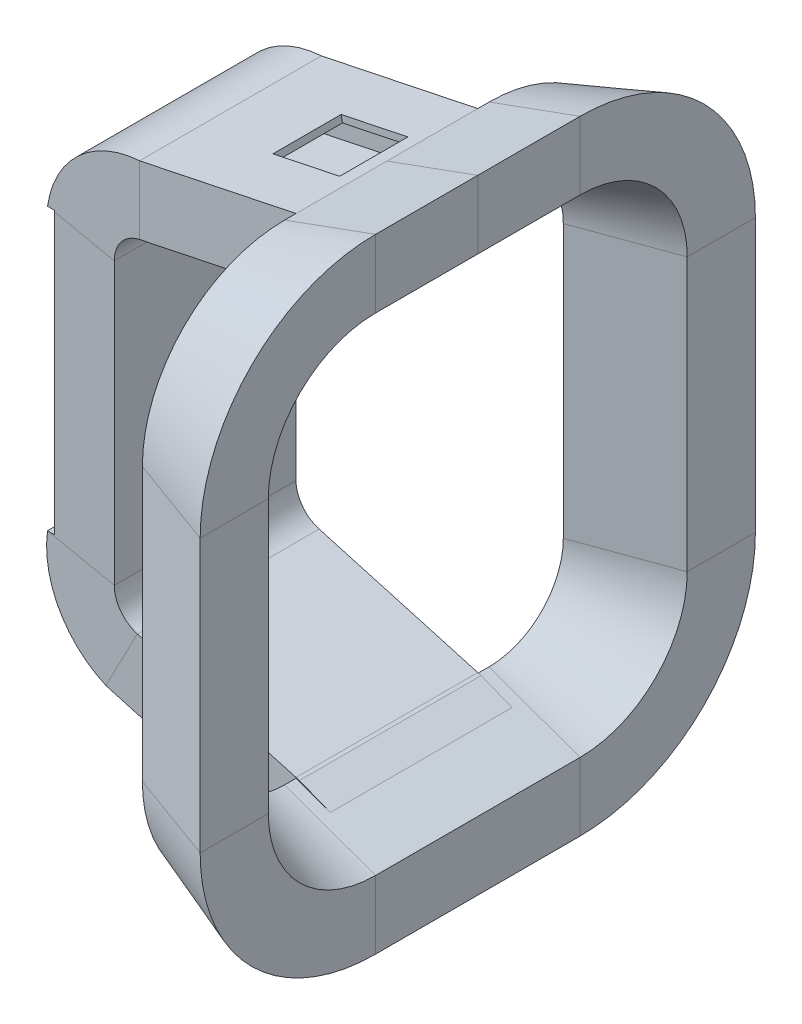
from build123d import *

# Parameters (mm, degrees)
SKETCH3_W          = 80
SKETCH3_H          = 30
SKETCH9_W          = 80
SKETCH9_H          = 1.501624929
CUT_EXTRUDE1_DEPTH = 20
CUT_EXTRUDE1_TAPER = -6
SHELL10_START      = -37
SHELL10_DEPTH      = 74
SHELL10_START_2    = -45
SHELL10_2_DEPTH    = 90
SKETCH10_W         = 30
SKETCH10_H         = 30
CUT_EXTRUDE3_DEPTH = 20
SKETCH12_W         = 80
SKETCH12_H         = 123.681881054
CUT_EXTRUDE6_DEPTH = 3
SPLIT1_START       = -40
SPLIT1_DEPTH       = 80
SPLIT1_2_DEPTH     = 80
SPLIT1_3_DEPTH     = 3
SPLIT1_START_2     = 37
SPLIT1_4_DEPTH     = 3
SPLIT1_START_3     = -37
SPLIT1_5_DEPTH     = 22
SPLIT1_START_4     = 15
SPLIT1_6_DEPTH     = 22


with BuildPart() as part:
    # Sweep1: sweep along a path in Sketch1
    with BuildLine(Plane(origin=(0, 0, 0), x_dir=(0, 0, -1), z_dir=(1, 0, 0))) as sweep1_path:
        Line((-45, 100), (45, 100))
        ThreePointArc((45, 100), (73.284271247, 88.284271247), (85, 60))
        Line((85, 60), (85, -60))
        ThreePointArc((85, -60), (73.284271247, -88.284271247), (45, -100))
        Line((45, -100), (-45, -100))
        ThreePointArc((-45, -100), (-73.284271247, -88.284271247), (-85, -60))
        Line((-85, -60), (-85, 60))
        ThreePointArc((-85, 60), (-73.284271247, 88.284271247), (-45, 100))
    # Sketch2 → Sweep1 (sweep)
    with BuildSketch(Plane.XY):
        Polygon((-20, 92.638796882), (-20, 122.638796882), (20, 137.197606252), (20, 107.197606252), align=None)
    sweep(path=sweep1_path.line)

    # Sweep2: sweep along a path in Sketch4
    with BuildLine(Plane.XY) as sweep2_path:
        Line((-20, 92.638796882), (-88.852967931, 78.306964082))
        ThreePointArc((-88.852967931, 78.306964082), (-96.861435242, 73.43415539), (-100, 64.600740168))
        Line((-100, 64.600740168), (-100, -59.081140886))
        ThreePointArc((-100, -59.081140886), (-97.167430364, -67.524392573), (-89.815928706, -72.551058781))
        Line((-89.815928706, -72.551058781), (-20, -92.32939808))
        Line((-20, -92.32939808), (-4.200687465, -96.805227161))
    # Sketch3 → Sweep2 (sweep)
    with BuildSketch(Plane.ZY.offset(20)):
        with Locations((0, 107.638796882)):
            Rectangle(SKETCH3_W, SKETCH3_H)
    sweep(path=sweep2_path.line)

    # Sketch9 → Cut-Extrude1 (cut)
    with BuildSketch(Plane(origin=(36.421438719, -19.020702104, 0), x_dir=(0, 0, -1), z_dir=(0.88640300284302, -0.4629143728065455, 0))):
        with Locations((0, -88.503815115)):
            Rectangle(SKETCH9_W, SKETCH9_H)
    extrude(amount=-CUT_EXTRUDE1_DEPTH, taper=CUT_EXTRUDE1_TAPER, mode=Mode.SUBTRACT)

    # Shell10: read off the stored shape, not the designer's step
    # Shell10 outline → Shell10 (cut)
    with BuildSketch(Plane.XY.offset(SHELL10_START)):
        with BuildLine():
            Line((-20.822955032, 95.531799063), (17, 109.298228867))
            Line((17, 109.298228867), (17, 132.913162232))
            Line((17, 132.913162232), (-19.177044968, 119.7457947))
            Line((-19.177044968, 119.7457947), (-88.451274667, 105.326275728))
            ThreePointArc((-88.451274667, 105.326275728), (-113.597851914, 94.649643041), (-126.370479816, 70.500092129))
            Line((-126.370479816, 70.500092129), (-126.370479816, -53.181788924))
            ThreePointArc((-126.370479816, -53.181788924), (-121.760302537, -78.722392286), (-102.679618525, -96.315108173))
            Line((-102.679618525, -96.315108173), (-33.069732176, -116.035077188))
            Line((-33.069732176, -116.035077188), (-19.61788718, -119.845885974))
            Line((-19.61788718, -119.845885974), (-19.503553091, -119.626955462))
            Line((-19.503553091, -119.626955462), (17, -132.913162232))
            Line((17, -132.913162232), (17, -109.298228867))
            Line((17, -109.298228867), (-5.960628872, -100.941243398))
            Line((-5.960628872, -100.941243398), (-19.484544128, -95.593482034))
            Line((-19.484544128, -95.593482034), (-20.817699008, -95.215809058))
            Line((-20.817699008, -95.215809058), (-90.633627714, -75.437469759))
            ThreePointArc((-90.633627714, -75.437469759), (-99.560451157, -69.333660792), (-103, -59.081140886))
            Line((-103, -59.081140886), (-103, 64.600740168))
            ThreePointArc((-103, 64.600740168), (-99.188885651, 75.32703008), (-89.464318202, 81.244012064))
            Line((-89.464318202, 81.244012064), (-20.822955032, 95.531799063))
        make_face()
    extrude(amount=SHELL10_DEPTH, mode=Mode.SUBTRACT)

    # Shell10 2 outline → Shell10 2 (cut)
    with BuildSketch(Plane.XY.offset(SHELL10_START_2)):
        Polygon((-17, 120.538174267), (-17, 96.923240902), (17, 109.298228867), (17, 132.913162232), align=None)
        Polygon((17, -109.298228867), (-17, -96.923240902), (-17, -120.538174267), (17, -132.913162232), align=None)
    extrude(amount=SHELL10_2_DEPTH, mode=Mode.SUBTRACT)

    # Shell10 3: loft between two sections, ruled curve by curve
    shell10_3_from = [
        Edge.make_three_point_arc((-17, 60, -105.538174267), (-17, 102.806953545, -87.806953545), (-17, 120.538174267, -45)),
        Edge.make_three_point_arc((-17, 60, -81.923240902), (-17, 86.108674025, -71.108674025), (-17, 96.923240902, -45)),
        Edge.make_three_point_arc((-17, -120.538174267, -45), (-17, -102.806953545, -87.806953545), (-17, -60, -105.538174267)),
        Edge.make_three_point_arc((-17, -96.923240902, -45), (-17, -86.108674025, -71.108674025), (-17, -60, -81.923240902)),
        Edge.make_line((-17, 60, -105.538174267), (-17, -60, -105.538174267)),
        Edge.make_line((-17, -60, -81.923240902), (-17, 60, -81.923240902)),
        Edge.make_line((-17, 96.923240902, -45), (-17, 120.538174267, -45)),
        Edge.make_line((-17, -96.923240902, -45), (-17, -120.538174267, -45)),
    ]
    shell10_3_to = [
        Edge.make_three_point_arc((17, 60, -117.913162232), (17, 111.557391452, -96.557391452), (17, 132.913162232, -45)),
        Edge.make_three_point_arc((17, 60, -94.298228867), (17, 94.859111932, -79.859111932), (17, 109.298228867, -45)),
        Edge.make_three_point_arc((17, -132.913162232, -45), (17, -111.557391452, -96.557391452), (17, -60, -117.913162232)),
        Edge.make_three_point_arc((17, -109.298228867, -45), (17, -94.859111932, -79.859111932), (17, -60, -94.298228867)),
        Edge.make_line((17, 60, -117.913162232), (17, -60, -117.913162232)),
        Edge.make_line((17, -60, -94.298228867), (17, 60, -94.298228867)),
        Edge.make_line((17, 109.298228867, -45), (17, 132.913162232, -45)),
        Edge.make_line((17, -109.298228867, -45), (17, -132.913162232, -45)),
    ]
    shell10_3 = Solid(Shell([*[Face.make_surface_from_curves(shell10_3_from[k], shell10_3_to[k]) for k in range(8)], Face(Wire(shell10_3_from)), Face(Wire(shell10_3_to))]))
    add(shell10_3, mode=Mode.SUBTRACT)

    # Shell10 4: loft between two sections, ruled curve by curve
    shell10_4_from = [
        Edge.make_three_point_arc((-17, -60, 105.538174267), (-17, -102.806953545, 87.806953545), (-17, -120.538174267, 45)),
        Edge.make_three_point_arc((-17, -60, 81.923240902), (-17, -86.108674025, 71.108674025), (-17, -96.923240902, 45)),
        Edge.make_three_point_arc((-17, 120.538174267, 45), (-17, 102.806953545, 87.806953545), (-17, 60, 105.538174267)),
        Edge.make_three_point_arc((-17, 96.923240902, 45), (-17, 86.108674025, 71.108674025), (-17, 60, 81.923240902)),
        Edge.make_line((-17, -60, 105.538174267), (-17, 60, 105.538174267)),
        Edge.make_line((-17, 60, 81.923240902), (-17, -60, 81.923240902)),
        Edge.make_line((-17, -96.923240902, 45), (-17, -120.538174267, 45)),
        Edge.make_line((-17, 96.923240902, 45), (-17, 120.538174267, 45)),
    ]
    shell10_4_to = [
        Edge.make_three_point_arc((17, -60, 117.913162232), (17, -111.557391452, 96.557391452), (17, -132.913162232, 45)),
        Edge.make_three_point_arc((17, -60, 94.298228867), (17, -94.859111932, 79.859111932), (17, -109.298228867, 45)),
        Edge.make_three_point_arc((17, 132.913162232, 45), (17, 111.557391452, 96.557391452), (17, 60, 117.913162232)),
        Edge.make_three_point_arc((17, 109.298228867, 45), (17, 94.859111932, 79.859111932), (17, 60, 94.298228867)),
        Edge.make_line((17, -60, 117.913162232), (17, 60, 117.913162232)),
        Edge.make_line((17, 60, 94.298228867), (17, -60, 94.298228867)),
        Edge.make_line((17, -109.298228867, 45), (17, -132.913162232, 45)),
        Edge.make_line((17, 109.298228867, 45), (17, 132.913162232, 45)),
    ]
    shell10_4 = Solid(Shell([*[Face.make_surface_from_curves(shell10_4_from[k], shell10_4_to[k]) for k in range(8)], Face(Wire(shell10_4_from)), Face(Wire(shell10_4_to))]))
    add(shell10_4, mode=Mode.SUBTRACT)

    # Sketch10 → Cut-Extrude3 (cut)
    with BuildSketch(Plane(origin=(-25.297880457, 121.53603633, 0), x_dir=(0.9790159938689951, 0.2037834236357412, 0), z_dir=(-0.2037834236357412, 0.9790159938689951, 0))):
        with Locations((-15.49634306, 0)):
            Rectangle(SKETCH10_W, SKETCH10_H)
    extrude(amount=-CUT_EXTRUDE3_DEPTH, mode=Mode.SUBTRACT)

    # Sketch12 → Cut-Extrude6 (cut)
    with BuildSketch(Plane.ZY.offset(129.370479816)):
        with Locations((0, 8.87330235)):
            Rectangle(SKETCH12_W, SKETCH12_H)
    extrude(amount=-CUT_EXTRUDE6_DEPTH, mode=Mode.SUBTRACT)

    # Split1: read off the stored shape, not the designer's step
    # Split1 outline → Split1 (cut)
    with BuildSketch(Plane.XY.offset(SPLIT1_START)):
        with BuildLine():
            Line((-20, -92.32939808), (-89.815928706, -72.551058781))
            ThreePointArc((-89.815928706, -72.551058781), (-97.167430364, -67.524392573), (-100, -59.081140886))
            Line((-100, -59.081140886), (-100, 64.600740168))
            ThreePointArc((-100, 64.600740168), (-96.861435242, 73.43415539), (-88.852967931, 78.306964082))
            Line((-88.852967931, 78.306964082), (-20, 92.638796882))
            Line((-20, 92.638796882), (-20, 122.638796882))
            Line((-20, 122.638796882), (-88.852967931, 108.306964082))
            ThreePointArc((-88.852967931, 108.306964082), (-115.790182146, 96.70865948), (-129.370479816, 70.714242877))
            Line((-129.370479816, 70.714242877), (-126.370479816, 70.714242877))
            Line((-126.370479816, 70.714242877), (-126.370479816, -52.967638177))
            Line((-126.370479816, -52.967638177), (-129.370479816, -52.967638177))
            ThreePointArc((-129.370479816, -52.967638177), (-124.282475377, -80.360838108), (-103.70335989, -99.143148866))
            Line((-103.70335989, -99.143148866), (-33.887431184, -118.921488166))
            Line((-33.887431184, -118.921488166), (-20, -122.855695317))
            Line((-20, -122.855695317), (-20, -92.32939808))
        make_face()
    extrude(amount=SPLIT1_DEPTH, mode=Mode.SUBTRACT)


with BuildPart() as body_2:
    # Split1 2 outline → Split1 2 (new body)
    with BuildSketch(Plane.XY.offset(SPLIT1_START)):
        Polygon((-20, 119.574495564), (-20, 122.638796882), (-25.783808251, 121.434889842), (-25.17245798, 118.49784186), align=None)
        with BuildLine():
            Line((-20, 92.638796882), (-20, 95.831330199))
            Line((-20, 95.831330199), (-20.822955032, 95.531799063))
            Line((-20.822955032, 95.531799063), (-89.464318202, 81.244012064))
            ThreePointArc((-89.464318202, 81.244012064), (-99.188885651, 75.32703008), (-103, 64.600740168))
            Line((-103, 64.600740168), (-103, -59.081140886))
            ThreePointArc((-103, -59.081140886), (-99.560451157, -69.333660792), (-90.633627714, -75.437469759))
            Line((-90.633627714, -75.437469759), (-20.817699008, -95.215809058))
            Line((-20.817699008, -95.215809058), (-20, -95.447457175))
            Line((-20, -95.447457175), (-20, -92.32939808))
            Line((-20, -92.32939808), (-89.815928706, -72.551058781))
            ThreePointArc((-89.815928706, -72.551058781), (-97.167430364, -67.524392573), (-100, -59.081140886))
            Line((-100, -59.081140886), (-100, 64.600740168))
            ThreePointArc((-100, 64.600740168), (-96.861435242, 73.43415539), (-88.852967931, 78.306964082))
            Line((-88.852967931, 78.306964082), (-20, 92.638796882))
        make_face()
        with BuildLine():
            Line((-54.542937796, 112.384339151), (-55.154288067, 115.321387133))
            Line((-55.154288067, 115.321387133), (-88.852967931, 108.306964082))
            ThreePointArc((-88.852967931, 108.306964082), (-115.790182146, 96.70865948), (-129.370479816, 70.714242877))
            Line((-129.370479816, 70.714242877), (-126.370479816, 70.714242877))
            Line((-126.370479816, 70.714242877), (-126.370479816, 70.500092129))
            ThreePointArc((-126.370479816, 70.500092129), (-113.597851914, 94.649643041), (-88.451274667, 105.326275728))
            Line((-88.451274667, 105.326275728), (-54.542937796, 112.384339151))
        make_face()
        with BuildLine():
            Line((-126.370479816, -53.181788924), (-126.370479816, -52.967638177))
            Line((-126.370479816, -52.967638177), (-129.370479816, -52.967638177))
            ThreePointArc((-129.370479816, -52.967638177), (-124.282475377, -80.360838108), (-103.70335989, -99.143148866))
            Line((-103.70335989, -99.143148866), (-33.887431184, -118.921488166))
            Line((-33.887431184, -118.921488166), (-20, -122.855695317))
            Line((-20, -122.855695317), (-20, -119.737636222))
            Line((-20, -119.737636222), (-33.069732176, -116.035077188))
            Line((-33.069732176, -116.035077188), (-102.679618525, -96.315108173))
            ThreePointArc((-102.679618525, -96.315108173), (-121.760302537, -78.722392286), (-126.370479816, -53.181788924))
        make_face()
    extrude(amount=SPLIT1_2_DEPTH)

    # Split1 3 outline → Split1 3 (add)
    with BuildSketch(Plane.XY.offset(SPLIT1_START)):
        with BuildLine():
            Line((-20, 95.831330199), (-20, 119.574495564))
            Line((-20, 119.574495564), (-25.17245798, 118.49784186))
            Line((-25.17245798, 118.49784186), (-25.783808251, 121.434889842))
            Line((-25.783808251, 121.434889842), (-55.154288067, 115.321387133))
            Line((-55.154288067, 115.321387133), (-54.542937796, 112.384339151))
            Line((-54.542937796, 112.384339151), (-88.451274667, 105.326275728))
            ThreePointArc((-88.451274667, 105.326275728), (-113.597851914, 94.649643041), (-126.370479816, 70.500092129))
            Line((-126.370479816, 70.500092129), (-126.370479816, -53.181788924))
            ThreePointArc((-126.370479816, -53.181788924), (-121.760302537, -78.722392286), (-102.679618525, -96.315108173))
            Line((-102.679618525, -96.315108173), (-33.069732176, -116.035077188))
            Line((-33.069732176, -116.035077188), (-20, -119.737636222))
            Line((-20, -119.737636222), (-20, -95.447457175))
            Line((-20, -95.447457175), (-20.817699008, -95.215809058))
            Line((-20.817699008, -95.215809058), (-90.633627714, -75.437469759))
            ThreePointArc((-90.633627714, -75.437469759), (-99.560451157, -69.333660792), (-103, -59.081140886))
            Line((-103, -59.081140886), (-103, 64.600740168))
            ThreePointArc((-103, 64.600740168), (-99.188885651, 75.32703008), (-89.464318202, 81.244012064))
            Line((-89.464318202, 81.244012064), (-20.822955032, 95.531799063))
            Line((-20.822955032, 95.531799063), (-20, 95.831330199))
        make_face()
    extrude(amount=SPLIT1_3_DEPTH)

    # Split1 4 outline → Split1 4 (add)
    with BuildSketch(Plane.XY.offset(SPLIT1_START_2)):
        with BuildLine():
            Line((-20, 95.831330199), (-20, 119.574495564))
            Line((-20, 119.574495564), (-25.17245798, 118.49784186))
            Line((-25.17245798, 118.49784186), (-25.783808251, 121.434889842))
            Line((-25.783808251, 121.434889842), (-55.154288067, 115.321387133))
            Line((-55.154288067, 115.321387133), (-54.542937796, 112.384339151))
            Line((-54.542937796, 112.384339151), (-88.451274667, 105.326275728))
            ThreePointArc((-88.451274667, 105.326275728), (-113.597851914, 94.649643041), (-126.370479816, 70.500092129))
            Line((-126.370479816, 70.500092129), (-126.370479816, -53.181788924))
            ThreePointArc((-126.370479816, -53.181788924), (-121.760302537, -78.722392286), (-102.679618525, -96.315108173))
            Line((-102.679618525, -96.315108173), (-33.069732176, -116.035077188))
            Line((-33.069732176, -116.035077188), (-20, -119.737636222))
            Line((-20, -119.737636222), (-20, -95.447457175))
            Line((-20, -95.447457175), (-20.817699008, -95.215809058))
            Line((-20.817699008, -95.215809058), (-90.633627714, -75.437469759))
            ThreePointArc((-90.633627714, -75.437469759), (-99.560451157, -69.333660792), (-103, -59.081140886))
            Line((-103, -59.081140886), (-103, 64.600740168))
            ThreePointArc((-103, 64.600740168), (-99.188885651, 75.32703008), (-89.464318202, 81.244012064))
            Line((-89.464318202, 81.244012064), (-20.822955032, 95.531799063))
            Line((-20.822955032, 95.531799063), (-20, 95.831330199))
        make_face()
    extrude(amount=SPLIT1_4_DEPTH)

    # Split1 5 outline → Split1 5 (add)
    with BuildSketch(Plane.XY.offset(SPLIT1_START_3)):
        Polygon((-25.17245798, 118.49784186), (-25.783808251, 121.434889842), (-55.154288067, 115.321387133), (-54.542937796, 112.384339151), align=None)
    extrude(amount=SPLIT1_5_DEPTH)

    # Split1 6 outline → Split1 6 (add)
    with BuildSketch(Plane.XY.offset(SPLIT1_START_4)):
        Polygon((-25.17245798, 118.49784186), (-25.783808251, 121.434889842), (-55.154288067, 115.321387133), (-54.542937796, 112.384339151), align=None)
    extrude(amount=SPLIT1_6_DEPTH)


solid = Compound([part.part, body_2.part])
